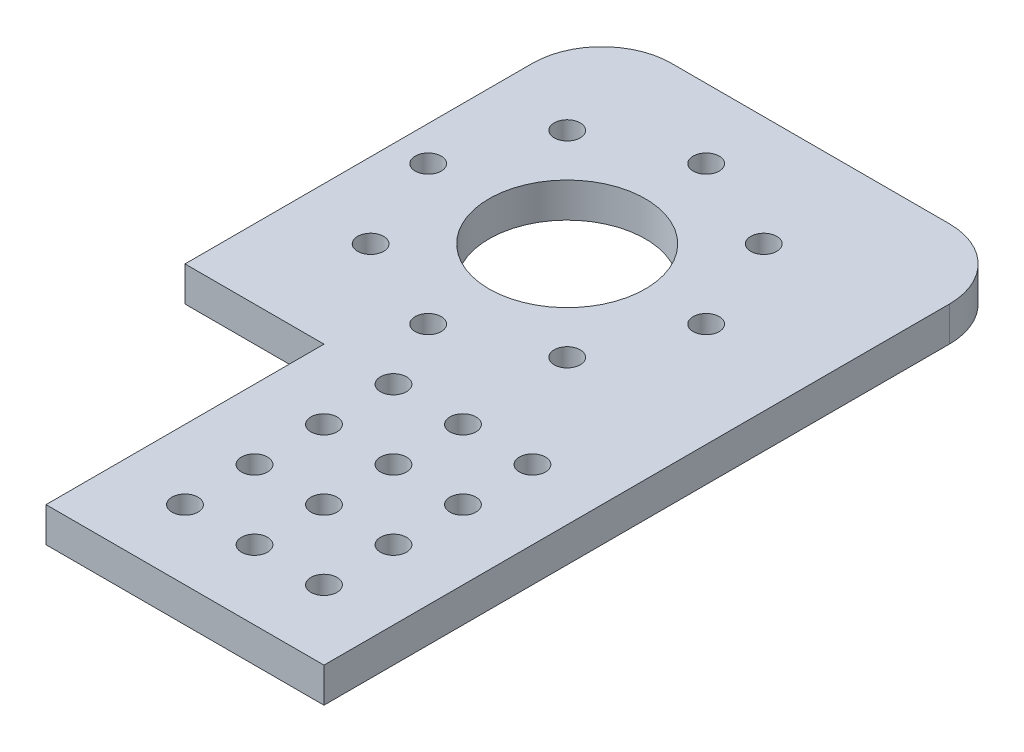
from build123d import *

# Parameters (mm, degrees)
SKETCH1_R           = 2.38125
SKETCH1_R_2         = 14.2875
BOSS_EXTRUDE1_DEPTH = 6.35
FILLET1_R           = 12.7
SKETCH2_R           = 2.38125
CUT_EXTRUDE1_DEPTH  = 137.930502446


with BuildPart() as part:
    # Sketch1 → Boss-Extrude1 (new body)
    with BuildSketch(Plane(origin=(0, 0, 0), x_dir=(1, 0, 0), z_dir=(0, 1, 0))):
        Polygon((0, 0), (50.8, 0), (50.8, 127), (-25.4, 127), (-25.4, 50.8), (0, 50.8), align=None)
        with Locations((12.7, 12.7)):
            Circle(SKETCH1_R, mode=Mode.SUBTRACT)
        with Locations((25.4, 12.7)):
            Circle(SKETCH1_R, mode=Mode.SUBTRACT)
        with Locations((38.1, 12.7)):
            Circle(SKETCH1_R, mode=Mode.SUBTRACT)
        with Locations((25.4, 25.4)):
            Circle(SKETCH1_R, mode=Mode.SUBTRACT)
        with Locations((38.1, 25.4)):
            Circle(SKETCH1_R, mode=Mode.SUBTRACT)
        with Locations((25.4, 38.1)):
            Circle(SKETCH1_R, mode=Mode.SUBTRACT)
        with Locations((38.1, 38.1)):
            Circle(SKETCH1_R, mode=Mode.SUBTRACT)
        with Locations((12.7, 25.4)):
            Circle(SKETCH1_R, mode=Mode.SUBTRACT)
        with Locations((12.7, 38.1)):
            Circle(SKETCH1_R, mode=Mode.SUBTRACT)
        with Locations((6.35, 88.9)):
            Circle(SKETCH1_R_2, mode=Mode.SUBTRACT)
        with Locations((12.7, 50.8)):
            Circle(SKETCH1_R, mode=Mode.SUBTRACT)
        with Locations((25.4, 50.8)):
            Circle(SKETCH1_R, mode=Mode.SUBTRACT)
        with Locations((38.1, 50.8)):
            Circle(SKETCH1_R, mode=Mode.SUBTRACT)
    extrude(amount=BOSS_EXTRUDE1_DEPTH)

    # Fillet1
    fillet1_edges = [part.edges().sort_by_distance(p)[0] for p in [
        (-25.4, 3.175, -127),
        (50.8, 3.175, -127),
    ]]
    fillet(fillet1_edges, radius=FILLET1_R)

    # Sketch2 → Cut-Extrude1 (cut, through all)
    with BuildSketch(Plane(origin=(0, 6.35, 0), x_dir=(1, 0, 0), z_dir=(0, 1, 0))):
        with Locations((-19.05, 88.9)):
            Circle(SKETCH2_R)
        with Locations((-11.610512242, 106.860512242)):
            Circle(SKETCH2_R)
        with Locations((6.35, 114.3)):
            Circle(SKETCH2_R)
        with Locations((24.310512242, 106.860512242)):
            Circle(SKETCH2_R)
        with Locations((31.75, 88.9)):
            Circle(SKETCH2_R)
        with Locations((24.310512242, 70.939487758)):
            Circle(SKETCH2_R)
        with Locations((6.35, 63.5)):
            Circle(SKETCH2_R)
        with Locations((-11.610512242, 70.939487758)):
            Circle(SKETCH2_R)
    extrude(amount=-CUT_EXTRUDE1_DEPTH, mode=Mode.SUBTRACT)


solid = part.part
